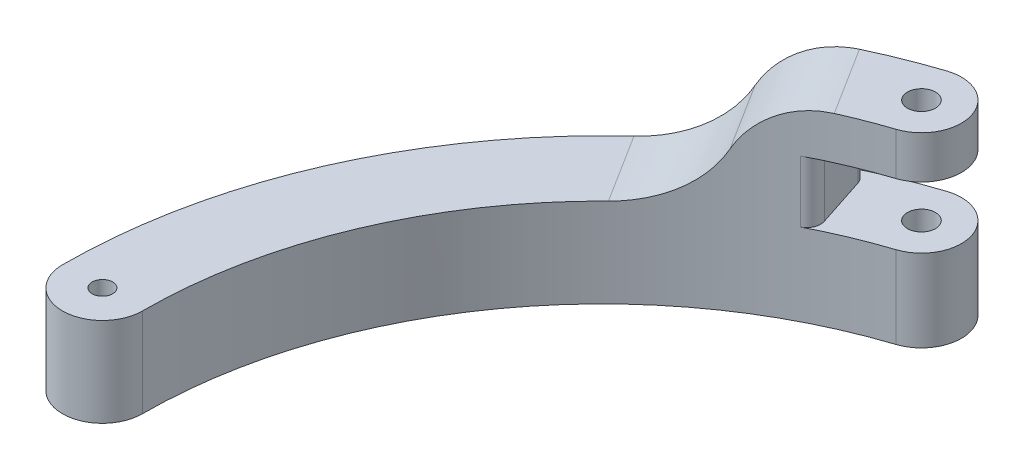
from build123d import *

# Parameters (mm, degrees)
SKETCH1_R               = 0.7499999999999986
SKETCH1_R_2             = 1.0249999999999995
BOSS_EXTRUDE1_DEPTH     = 6.510019999999999
BOSS_EXTRU_1_DEPTH      = 7.112
CONG_1_R                = 7.112
CONG_2_R                = 6.35
ENL_V_MAT_EXTRU_1_DEPTH = 4.444999999999999
ESQUISSE4_R             = 1.024999999999998
ENL_V_MAT_EXTRU_2_DEPTH = 57.18027536353634
CONG_3_R                = 1.016


with BuildPart() as part:
    # Sketch1 → Boss-Extrude1 (new body)
    with BuildSketch(Plane(origin=(0, 0, 0), x_dir=(1, 0, 0), z_dir=(0, 1, 0))):
        with BuildLine():
            ThreePointArc((-33.59051080682659, 0), (-27.195497439499345, 19.716169386615615), (-10.445442396451748, 31.92514916810793))
            ThreePointArc((-10.445442396451748, 31.92514916810793), (-8.576954256445317, 35.61090468912391), (-12.262709777461287, 37.4793928291303))
            ThreePointArc((-12.262709777461287, 37.4793928291303), (-31.926890187777666, 23.14633061338439), (-39.43448919317339, 0))
            ThreePointArc((-39.43448919317339, 0), (-36.512499999999996, -2.9219891931734026), (-33.59051080682659, 0))
        make_face()
        with Locations(Location((-36.512499999999996, 0, 0), (0, 0, 270))):
            Circle(SKETCH1_R, mode=Mode.SUBTRACT)
        with Locations(Location((-11.354076086956523, 34.702270998619134, 0), (0, 0, 270))):
            Circle(SKETCH1_R_2, mode=Mode.SUBTRACT)
    extrude(amount=BOSS_EXTRUDE1_DEPTH)

    # Esquisse1 → Boss.-Extru.1 (add)
    with BuildSketch(Plane(origin=(0, 6.510019999999999, 0), x_dir=(1, 0, 0), z_dir=(0, 1, 0))):
        with BuildLine():
            Line((-17.904180753250905, 28.421166897551096), (-21.0190975209346, 33.36579801731034))
            ThreePointArc((-21.0190975209346, 33.36579801731034), (-16.767530820930304, 35.69213986434075), (-12.262709777461293, 37.47939282913032))
            ThreePointArc((-12.262709777461293, 37.47939282913032), (-8.576954256445317, 35.610904689123906), (-10.44544239645175, 31.92514916810793))
            ThreePointArc((-10.44544239645175, 31.92514916810793), (-14.282673283409979, 30.40275744308238), (-17.904180753250905, 28.421166897551096))
        make_face()
    extrude(amount=BOSS_EXTRU_1_DEPTH)

    # Congé1
    cong_1_edges = [part.edges().sort_by_distance(p)[0] for p in [
        (-19.461639137092753, 6.510019999999999, -30.893482457430718),
    ]]
    fillet(cong_1_edges, radius=CONG_1_R - 0.0001)  # a hair under: the kernel refuses the full size

    # Congé2
    cong_2_edges = [part.edges().sort_by_distance(p)[0] for p in [
        (-19.461639137092753, 13.62202, -30.893482457430718),
    ]]
    fillet(cong_2_edges, radius=CONG_2_R)

    # Esquisse3 → Enlèv. mat.-Extru.1 (cut, symmetric)
    with BuildSketch(Plane(origin=(-12.262709777461295, 0, -37.479392829130326), x_dir=(0.3109640831758033, 0, 0.9504216637759433), z_dir=(-0.9504216637759433, 0, 0.3109640831758033))):
        Polygon((-5.92976249492949, 10.499999999999998), (8.153118343955157, 10.499999999999998), (8.153118343955159, 6), (-5.92976249492949, 6), align=None)
    extrude(amount=ENL_V_MAT_EXTRU_1_DEPTH, both=True, mode=Mode.SUBTRACT)

    # Esquisse4 → Enlèv. mat.-Extru.2 (cut, through all)
    with BuildSketch(Plane.XZ):
        with Locations(Location((-11.354076086956523, -34.702270998619134, 0), (0, 0, 270))):
            Circle(ESQUISSE4_R)
    extrude(amount=-ENL_V_MAT_EXTRU_2_DEPTH, mode=Mode.SUBTRACT)

    # Congé3
    cong_3_edges = [part.edges().sort_by_distance(p)[0] for p in [
        (-16.409183233920817, 8.25, -35.85829950683831),
        (-14.578207843975182, 8.25, -30.262159082282853),
    ]]
    fillet(cong_3_edges, radius=CONG_3_R)


solid = part.part
